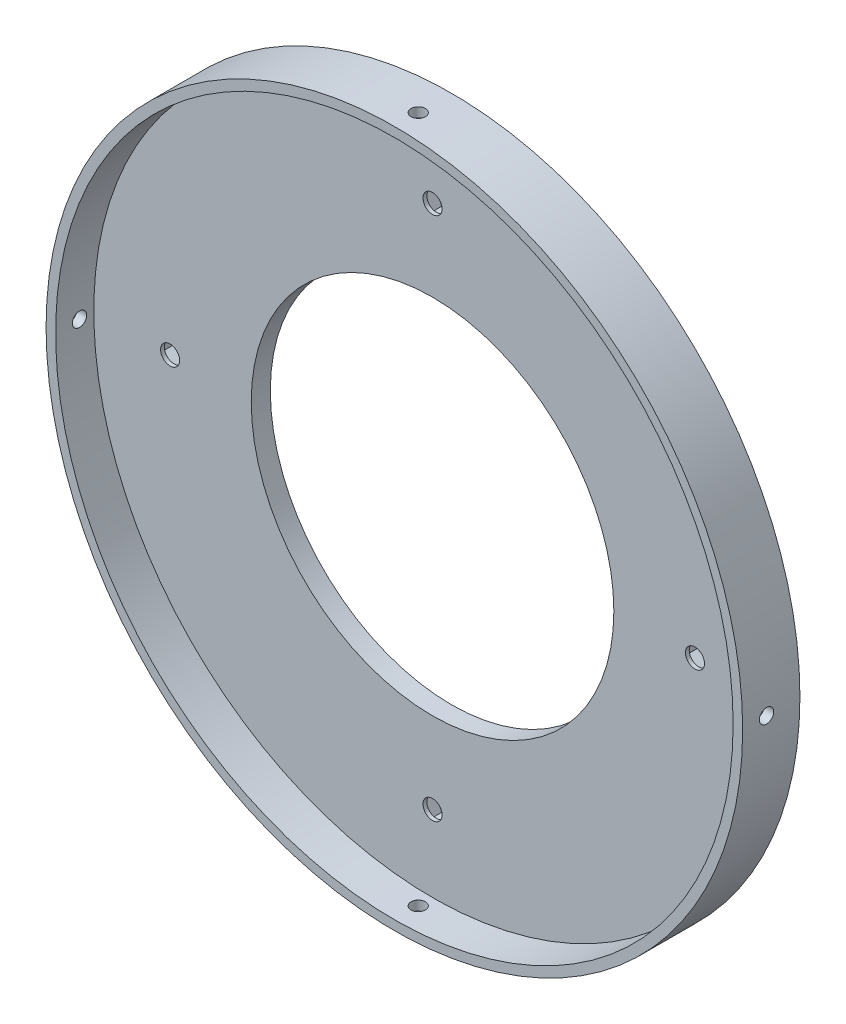
from build123d import *

# Parameters (mm, degrees)
SKETCH1_R               = 73
SKETCH1_R_2             = 38
BOSS_EXTRUDE1_DEPTH     = 4
SKETCH2_R               = 73
SKETCH2_R_2             = 71
BOSS_EXTRUDE2_DEPTH     = 8
CUT_EXTRUDE1_REACH      = 105.933
CUT_EXTRUDE1_END_RADIUS = 73
SKETCH3_R               = 1.5
CIRPATTERN1_COUNT       = 4
F_4_0MM_DOWEL_HOLE1_D   = 4
CUT_EXTRUDE2_DEPTH      = 3.2


with BuildPart() as part:
    # Sketch1 → Boss-Extrude1 (new body)
    with BuildSketch(Plane.XY):
        Circle(SKETCH1_R)
        Circle(SKETCH1_R_2, mode=Mode.SUBTRACT)
    extrude(amount=BOSS_EXTRUDE1_DEPTH)

    # Sketch2 → Boss-Extrude2 (add)
    with BuildSketch(Plane.XY.offset(4)):
        Circle(SKETCH2_R)
        Circle(SKETCH2_R_2, mode=Mode.SUBTRACT)
    extrude(amount=BOSS_EXTRUDE2_DEPTH)

    # Cut-Extrude1: up to this cylinder (the profile starts inside it)
    cut_extrude1_end = Plane(origin=(0, 0, 7), z_dir=(0, 0, -1)) * Cylinder(CUT_EXTRUDE1_END_RADIUS, 358.866, mode=Mode.PRIVATE)
    # Sketch3 → Cut-Extrude1 (cut, up to the surface)
    with BuildSketch(Plane(origin=(0, 0, 0), x_dir=(1, 0, 0), z_dir=(0, 1, 0)), mode=Mode.PRIVATE) as cut_extrude1_sk1:
        with Locations((0, -7)):
            Circle(SKETCH3_R)
    cut_extrude1_tool1 = extrude(cut_extrude1_sk1.sketch, amount=-CUT_EXTRUDE1_REACH, mode=Mode.PRIVATE) & cut_extrude1_end
    cut_extrude1 = cut_extrude1_tool1.solids().sort_by_distance((0, 0, 7))[0]
    add(cut_extrude1, mode=Mode.SUBTRACT)

    # CirPattern1: Cut-Extrude1 ×4 about axis
    cirpattern1_axis = Axis((0, 0, 4), (0, 0, -1))
    for i in range(1, CIRPATTERN1_COUNT):
        add(cut_extrude1.rotate(cirpattern1_axis, i * 360 / CIRPATTERN1_COUNT), mode=Mode.SUBTRACT)

    # Ø4.0mm Dowel Hole1 (through all)
    with Locations(Plane(origin=(0, 0, 0), x_dir=(-1, 0, 0), z_dir=(0, 0, -1))):
        with Locations((0, 55), (55, 0), (0, -55), (-55, 0)):
            Hole(F_4_0MM_DOWEL_HOLE1_D / 2)

    # Sketch13 → Cut-Extrude2 (cut)
    with BuildSketch(Plane(origin=(0, 0, 0), x_dir=(-1, 0, 0), z_dir=(0, 0, -1))):
        Polygon((4.041451884, 55), (2.020725942, 58.5), (-2.020725942, 58.5), (-4.041451884, 55), (-2.020725942, 51.5), (2.020725942, 51.5), align=None)
        Polygon((55, -4.041451884), (58.5, -2.020725942), (58.5, 2.020725942), (55, 4.041451884), (51.5, 2.020725942), (51.5, -2.020725942), align=None)
        Polygon((-4.041451884, -55), (-2.020725942, -58.5), (2.020725942, -58.5), (4.041451884, -55), (2.020725942, -51.5), (-2.020725942, -51.5), align=None)
        Polygon((-55, 4.041451884), (-58.5, 2.020725942), (-58.5, -2.020725942), (-55, -4.041451884), (-51.5, -2.020725942), (-51.5, 2.020725942), align=None)
    extrude(amount=-CUT_EXTRUDE2_DEPTH, mode=Mode.SUBTRACT)


solid = part.part
